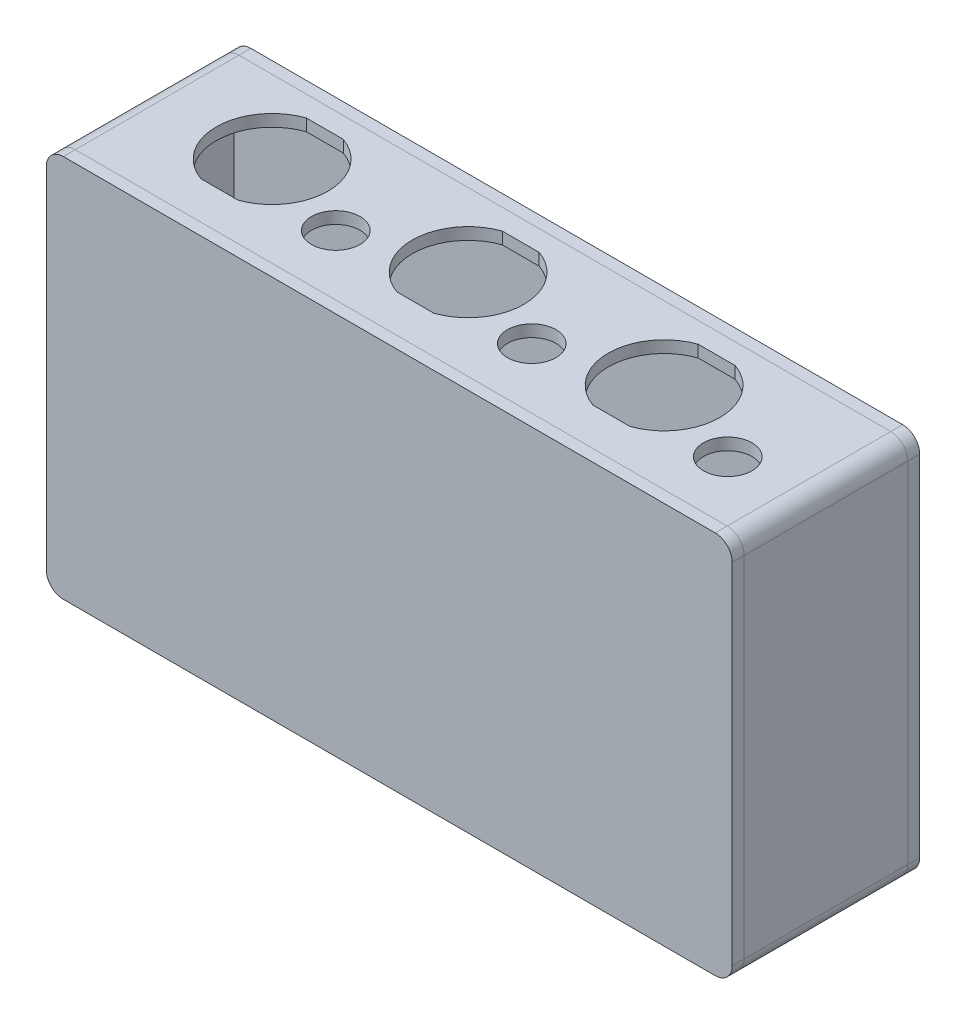
from build123d import *

# Parameters (mm, degrees)
BOSS_EXTRUDE1_DEPTH      = 2.54
BOSS_EXTRUDE1_DEPTH_BACK = 25.4
CUT_EXTRUDE1_DEPTH       = 2.54
SKETCH4_R                = 3.6195
CUT_EXTRUDE3_DEPTH       = 2.54
FILLET1_R                = 2.54
SKETCH3_W                = 11.508
SKETCH3_H                = 9.508
CUT_EXTRUDE2_DEPTH       = 1.27
SKETCH7_W                = 14.782
SKETCH7_H                = 12.682999998
BOSS_EXTRUDE2_DEPTH      = 2.54
SHELL1_START             = -23.622
SHELL1_DEPTH             = 24.384
SPLIT1_START             = -25.4
SPLIT1_DEPTH             = 1.778
SPLIT1_2_DEPTH           = 1.778
SPLIT1_START_2           = 0.762
SPLIT1_3_DEPTH           = 1.778
SPLIT1_4_DEPTH           = 1.778


# Read off the part's stored shape, not the designer's step: Shell1, Split1
with BuildPart() as part:
    # Sketch1 → Boss-Extrude1 (new, two sides: drawn at the far end of the back side and taken through both)
    with BuildSketch(Plane.XY.offset(-BOSS_EXTRUDE1_DEPTH_BACK)):
        Polygon((-39.990606027, -18.440246583), (62.244393973, -18.440246583), (62.244393973, -15.392246583), (62.244393973, 26.517753417), (62.244393973, 38.709753417), (-39.990606027, 38.709753417), (-39.990606027, 26.517753417), (-39.990606027, -15.392246583), align=None)
    extrude(amount=BOSS_EXTRUDE1_DEPTH + BOSS_EXTRUDE1_DEPTH_BACK)

    # Sketch2 → Cut-Extrude1 (cut)
    with BuildSketch(Plane.ZY.offset(39.990606027)):
        Polygon((-20.133, 2.102332927), (-20.133, 9.023173906), (-19.222946487, 9.93322742), (-17.713785822, 9.844771641), (-17.205002954, 9.338498651), (-16.304724783, 9.29589869), (-15.417, 8.408173907), (-15.417, 2.717332928), (-16.31457951, 1.819753417), (-17.067151023, 1.819753417), (-17.744895832, 1.278911755), (-19.222946485, 1.192279414), align=None)
    extrude(amount=-CUT_EXTRUDE1_DEPTH, mode=Mode.SUBTRACT)

    # Sketch4 → Cut-Extrude3 (cut)
    with BuildSketch(Plane(origin=(0, 38.709753417, 0), x_dir=(1, 0, 0), z_dir=(0, 1, 0))):
        with Locations(Location((-7.605606027, 8.2169, 0), (0, 0, 180))):
            Circle(SKETCH4_R)
        with Locations(Location((21.604393973, 8.2169, 0), (0, 0, 180))):
            Circle(SKETCH4_R)
        with Locations(Location((50.814393973, 8.2169, 0), (0, 0, 180))):
            Circle(SKETCH4_R)
        with BuildLine():
            Line((-24.331857157, 20.5486), (-18.819354898, 20.5486))
            ThreePointArc((-18.819354898, 20.5486), (-13.257106027, 12.7), (-18.819354898, 4.8514))
            Line((-18.819354898, 4.8514), (-24.331857157, 4.8514))
            ThreePointArc((-24.331857157, 4.8514), (-29.894106027, 12.7), (-24.331857157, 20.5486))
        make_face()
        with BuildLine():
            Line((10.390645102, 4.8514), (4.878142843, 4.8514))
            ThreePointArc((4.878142843, 4.8514), (-0.684106027, 12.7), (4.878142843, 20.5486))
            Line((4.878142843, 20.5486), (10.390645102, 20.5486))
            ThreePointArc((10.390645102, 20.5486), (15.952893973, 12.7), (10.390645102, 4.8514))
        make_face()
        with BuildLine():
            Line((39.600645102, 4.8514), (34.088142843, 4.8514))
            ThreePointArc((34.088142843, 4.8514), (28.525893973, 12.7), (34.088142843, 20.5486))
            Line((34.088142843, 20.5486), (39.600645102, 20.5486))
            ThreePointArc((39.600645102, 20.5486), (45.162893973, 12.7), (39.600645102, 4.8514))
        make_face()
    extrude(amount=-CUT_EXTRUDE3_DEPTH, mode=Mode.SUBTRACT)

    # Fillet1
    fillet1_edges = [part.edges().sort_by_distance(p)[0] for p in [
        (-39.990606027, 38.709753417, -11.43),
        (62.244393973, 38.709753417, -11.43),
        (62.244393973, -18.440246583, -11.43),
        (-39.990606027, -18.440246583, -11.43),
    ]]
    fillet(fillet1_edges, radius=FILLET1_R)

    # Sketch3 → Cut-Extrude2 (cut)
    with BuildSketch(Plane.ZY.offset(39.990606027)):
        with Locations((-8.929, 4.610253417)):
            Rectangle(SKETCH3_W, SKETCH3_H)
    extrude(amount=-CUT_EXTRUDE2_DEPTH, mode=Mode.SUBTRACT)

    # Sketch7 → Boss-Extrude2 (add)
    with BuildSketch(Plane.ZY.offset(39.990606027)):
        with Locations((-8.026, 5.562753418)):
            Rectangle(SKETCH7_W, SKETCH7_H)
    extrude(amount=-BOSS_EXTRUDE2_DEPTH)

    # Shell1 outline → Shell1 (cut)
    with BuildSketch(Plane.XY.offset(SHELL1_START)):
        with BuildLine():
            Line((-38.212606027, 1.819753417), (-38.212606027, -15.900246583))
            ThreePointArc((-38.212606027, -15.900246583), (-37.989421394, -16.43906195), (-37.450606027, -16.662246583))
            Line((-37.450606027, -16.662246583), (59.704393973, -16.662246583))
            ThreePointArc((59.704393973, -16.662246583), (60.24320934, -16.43906195), (60.466393973, -15.900246583))
            Line((60.466393973, -15.900246583), (60.466393973, 36.169753417))
            ThreePointArc((60.466393973, 36.169753417), (60.24320934, 36.708568784), (59.704393973, 36.931753417))
            Line((59.704393973, 36.931753417), (-37.450606027, 36.931753417))
            ThreePointArc((-37.450606027, 36.931753417), (-37.989421394, 36.708568784), (-38.212606027, 36.169753417))
            Line((-38.212606027, 36.169753417), (-38.212606027, 1.819753417))
        make_face()
    extrude(amount=SHELL1_DEPTH, mode=Mode.SUBTRACT)

    # Split1 2 outline → Split1 2 (cut)
    with BuildSketch(Plane.XY.offset(SPLIT1_START)):
        with BuildLine():
            Line((-37.450606027, -18.440246583), (59.704393973, -18.440246583))
            ThreePointArc((59.704393973, -18.440246583), (61.500445197, -17.696297807), (62.244393973, -15.900246583))
            Line((62.244393973, -15.900246583), (62.244393973, 36.169753417))
            ThreePointArc((62.244393973, 36.169753417), (61.500445197, 37.965804641), (59.704393973, 38.709753417))
            Line((59.704393973, 38.709753417), (-37.450606027, 38.709753417))
            ThreePointArc((-37.450606027, 38.709753417), (-39.246657251, 37.965804641), (-39.990606027, 36.169753417))
            Line((-39.990606027, 36.169753417), (-39.990606027, -15.900246583))
            ThreePointArc((-39.990606027, -15.900246583), (-39.246657251, -17.696297807), (-37.450606027, -18.440246583))
        make_face()
    extrude(amount=SPLIT1_2_DEPTH, mode=Mode.SUBTRACT)

    # Split1 3 outline → Split1 3 (cut)
    with BuildSketch(Plane.XY.offset(SPLIT1_START_2)):
        with BuildLine():
            Line((-37.450606027, -18.440246583), (59.704393973, -18.440246583))
            ThreePointArc((59.704393973, -18.440246583), (61.500445197, -17.696297807), (62.244393973, -15.900246583))
            Line((62.244393973, -15.900246583), (62.244393973, 36.169753417))
            ThreePointArc((62.244393973, 36.169753417), (61.500445197, 37.965804641), (59.704393973, 38.709753417))
            Line((59.704393973, 38.709753417), (-37.450606027, 38.709753417))
            ThreePointArc((-37.450606027, 38.709753417), (-39.246657251, 37.965804641), (-39.990606027, 36.169753417))
            Line((-39.990606027, 36.169753417), (-39.990606027, -15.900246583))
            ThreePointArc((-39.990606027, -15.900246583), (-39.246657251, -17.696297807), (-37.450606027, -18.440246583))
        make_face()
    extrude(amount=SPLIT1_3_DEPTH, mode=Mode.SUBTRACT)


with BuildPart() as body_2:
    # Split1 outline → Split1 (new body)
    with BuildSketch(Plane.XY.offset(SPLIT1_START)):
        with BuildLine():
            Line((-39.990606027, 36.169753417), (-39.990606027, -15.900246583))
            ThreePointArc((-39.990606027, -15.900246583), (-39.246657251, -17.696297807), (-37.450606027, -18.440246583))
            Line((-37.450606027, -18.440246583), (59.704393973, -18.440246583))
            ThreePointArc((59.704393973, -18.440246583), (61.500445197, -17.696297807), (62.244393973, -15.900246583))
            Line((62.244393973, -15.900246583), (62.244393973, 36.169753417))
            ThreePointArc((62.244393973, 36.169753417), (61.500445197, 37.965804641), (59.704393973, 38.709753417))
            Line((59.704393973, 38.709753417), (-37.450606027, 38.709753417))
            ThreePointArc((-37.450606027, 38.709753417), (-39.246657251, 37.965804641), (-39.990606027, 36.169753417))
        make_face()
    extrude(amount=SPLIT1_DEPTH)


with BuildPart() as body_3:
    # Split1 4 outline → Split1 4 (new body)
    with BuildSketch(Plane.XY.offset(SPLIT1_START_2)):
        with BuildLine():
            Line((-39.990606027, 36.169753417), (-39.990606027, -15.900246583))
            ThreePointArc((-39.990606027, -15.900246583), (-39.246657251, -17.696297807), (-37.450606027, -18.440246583))
            Line((-37.450606027, -18.440246583), (59.704393973, -18.440246583))
            ThreePointArc((59.704393973, -18.440246583), (61.500445197, -17.696297807), (62.244393973, -15.900246583))
            Line((62.244393973, -15.900246583), (62.244393973, 36.169753417))
            ThreePointArc((62.244393973, 36.169753417), (61.500445197, 37.965804641), (59.704393973, 38.709753417))
            Line((59.704393973, 38.709753417), (-37.450606027, 38.709753417))
            ThreePointArc((-37.450606027, 38.709753417), (-39.246657251, 37.965804641), (-39.990606027, 36.169753417))
        make_face()
    extrude(amount=SPLIT1_4_DEPTH)


solid = Compound([part.part, body_2.part, body_3.part])
